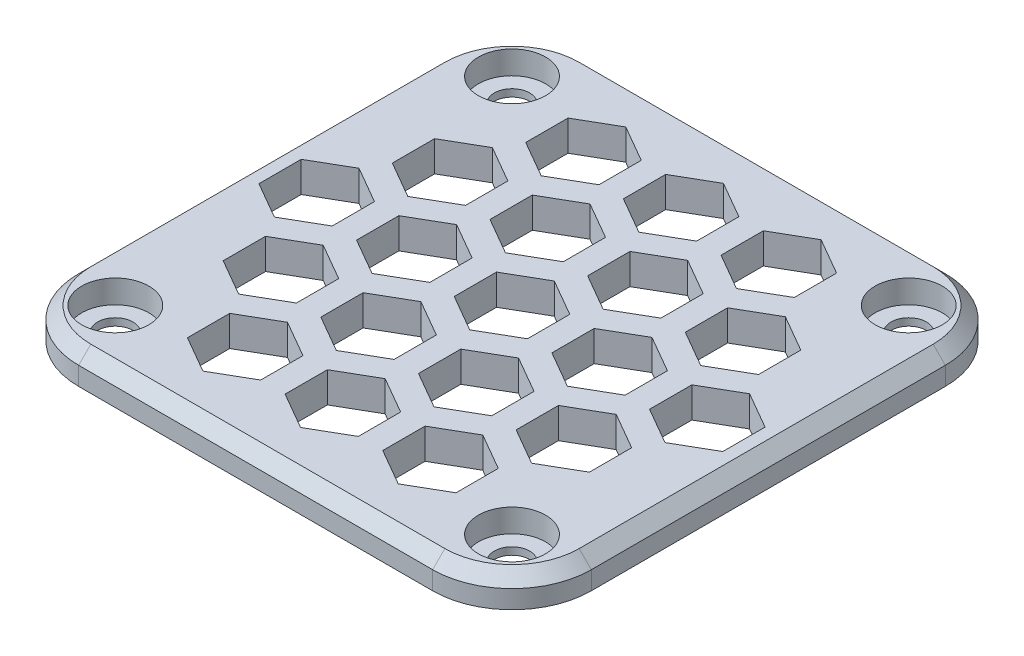
from build123d import *

# Parameters (mm, degrees)
BOSS_EXTRUDE1_DEPTH                                  = 2.5
CBORE_FOR_M2_5_HEX_SOCKET_HEAD_CAP_SCREW_D           = 2.9
CBORE_FOR_M2_5_HEX_SOCKET_HEAD_CAP_SCREW_CBORE_D     = 5.5
CBORE_FOR_M2_5_HEX_SOCKET_HEAD_CAP_SCREW_CBORE_DEPTH = 1.9
FILL_PATTERN2_DEPTH                                  = 2.5
CHAMFER1_SIZE                                        = 1


# Read off the part's stored shape, not the designer's step: Fill Pattern2
with BuildPart() as part:
    # Sketch1 → Boss-Extrude1 (new body)
    with BuildSketch(Plane(origin=(0, 0, 0), x_dir=(1, 0, 0), z_dir=(0, 1, 0))):
        with BuildLine():
            Line((6.5, 0), (35.5, 0))
            ThreePointArc((35.5, 0), (40.096194078, -1.903805922), (42, -6.5))
            Line((42, -6.5), (42, -35.5))
            ThreePointArc((42, -35.5), (40.096194078, -40.096194078), (35.5, -42))
            Line((35.5, -42), (6.5, -42))
            ThreePointArc((6.5, -42), (1.903805922, -40.096194078), (0, -35.5))
            Line((0, -35.5), (0, -6.5))
            ThreePointArc((0, -6.5), (1.903805922, -1.903805922), (6.5, 0))
        make_face()
    extrude(amount=BOSS_EXTRUDE1_DEPTH)

    # CBORE for M2.5 Hex Socket Head Cap Screw1 (through all)
    with Locations(Plane(origin=(0, 2.5, 0), x_dir=(1, 0, 0), z_dir=(0, 1, 0))):
        with Locations((4.75, -37.25), (4.75, -4.75), (37.25, -4.75), (37.25, -37.25)):
            CounterBoreHole(CBORE_FOR_M2_5_HEX_SOCKET_HEAD_CAP_SCREW_D / 2, CBORE_FOR_M2_5_HEX_SOCKET_HEAD_CAP_SCREW_CBORE_D / 2, CBORE_FOR_M2_5_HEX_SOCKET_HEAD_CAP_SCREW_CBORE_DEPTH)

    # Fill Pattern2 outline → Fill Pattern2 (cut)
    with BuildSketch(Plane(origin=(0, 0, 0), x_dir=(1, 0, 0), z_dir=(0, 1, 0))):
        Polygon((8, -19.267949192), (5, -17.535898385), (2, -19.267949192), (2, -22.732050808), (5, -24.464101615), (8, -22.732050808), align=None)
        Polygon((20, -26.196152423), (17, -24.464101615), (14, -26.196152423), (14, -29.660254038), (17, -31.392304845), (20, -29.660254038), align=None)
        Polygon((32, -33.124355653), (29, -31.392304845), (26, -33.124355653), (26, -36.588457268), (29, -38.320508076), (32, -36.588457268), align=None)
        Polygon((29, -3.679491924), (26, -5.411542732), (26, -8.875644347), (29, -10.607695155), (32, -8.875644347), (32, -5.411542732), align=None)
        Polygon((17, -10.607695155), (14, -12.339745962), (14, -15.803847577), (17, -17.535898385), (20, -15.803847577), (20, -12.339745962), align=None)
        Polygon((36, -12.339745962), (33, -10.607695155), (30, -12.339745962), (30, -15.803847577), (33, -17.535898385), (36, -15.803847577), align=None)
        Polygon((24, -5.411542732), (21, -3.679491924), (18, -5.411542732), (18, -8.875644347), (21, -10.607695155), (24, -8.875644347), align=None)
        Polygon((9, -24.464101615), (6, -26.196152423), (6, -29.660254038), (9, -31.392304845), (12, -29.660254038), (12, -26.196152423), align=None)
        Polygon((21, -17.535898385), (18, -19.267949192), (18, -22.732050808), (21, -24.464101615), (24, -22.732050808), (24, -19.267949192), align=None)
        Polygon((30, -26.196152423), (30, -29.660254038), (33, -31.392304845), (36, -29.660254038), (36, -26.196152423), (33, -24.464101615), align=None)
        Polygon((26, -19.267949192), (26, -22.732050808), (29, -24.464101615), (32, -22.732050808), (32, -19.267949192), (29, -17.535898385), align=None)
        Polygon((16, -19.267949192), (13, -17.535898385), (10, -19.267949192), (10, -22.732050808), (13, -24.464101615), (16, -22.732050808), align=None)
        Polygon((28, -26.196152423), (25, -24.464101615), (22, -26.196152423), (22, -29.660254038), (25, -31.392304845), (28, -29.660254038), align=None)
        Polygon((25, -10.607695155), (22, -12.339745962), (22, -15.803847577), (25, -17.535898385), (28, -15.803847577), (28, -12.339745962), align=None)
        Polygon((10, -33.124355653), (10, -36.588457268), (13, -38.320508076), (16, -36.588457268), (16, -33.124355653), (13, -31.392304845), align=None)
        Polygon((10, -5.411542732), (10, -8.875644347), (13, -10.607695155), (16, -8.875644347), (16, -5.411542732), (13, -3.679491924), align=None)
        Polygon((12, -12.339745962), (9, -10.607695155), (6, -12.339745962), (6, -15.803847577), (9, -17.535898385), (12, -15.803847577), align=None)
        Polygon((37, -17.535898385), (34, -19.267949192), (34, -22.732050808), (37, -24.464101615), (40, -22.732050808), (40, -19.267949192), align=None)
        Polygon((24, -33.124355653), (21, -31.392304845), (18, -33.124355653), (18, -36.588457268), (21, -38.320508076), (24, -36.588457268), align=None)
    extrude(amount=FILL_PATTERN2_DEPTH, mode=Mode.SUBTRACT)

    # Chamfer1
    chamfer1_edges = [part.edges().sort_by_distance(p)[0] for p in [
        (40.096194078, 2.5, 1.903805922),
        (21, 2.5, 0),
        (1.903805922, 2.5, 1.903805922),
        (0, 2.5, 21),
        (1.903805922, 2.5, 40.096194078),
        (21, 2.5, 42),
        (40.096194078, 2.5, 40.096194078),
        (42, 2.5, 21),
    ]]
    chamfer(chamfer1_edges, length=CHAMFER1_SIZE)


solid = part.part
